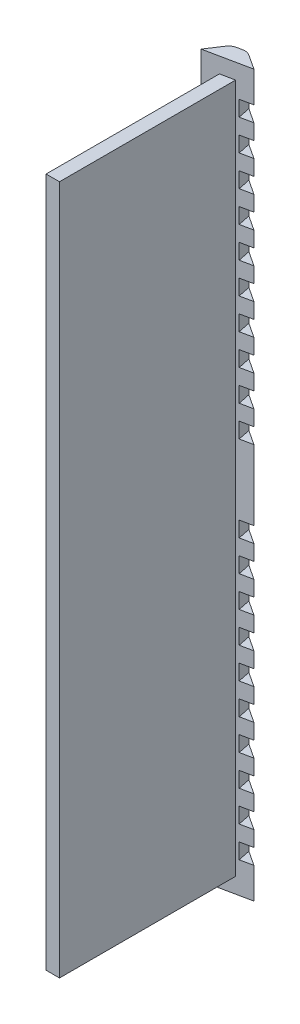
from build123d import *

# Parameters (mm, degrees)
BOSS_EXTRUDE1_START       = -8.15
BOSS_EXTRUDE1_DEPTH       = 66.8
SKETCH2_W                 = 4.327471502
SKETCH2_H                 = 69.8
BOSS_EXTRUDE2_DEPTH       = 1.5
CUT_EXTRUDE1_DEPTH        = 69.8
FILLET1_R                 = 1
CUT_EXTRUDE2_REACH        = 72.887
SKETCH6_W                 = 1.207106782
SKETCH6_H                 = 1.5
SKETCH6_W_2               = 1.207106781
LPATTERN1_COUNT           = 10
LPATTERN1_PITCH           = 3
MIRROR1_COPY_1_REACH      = 72.887
MIRROR1_COPY_1_SKETCH_W   = 1.207106782
MIRROR1_COPY_1_SKETCH_H   = 1.5
MIRROR1_COPY_1_SKETCH_W_2 = 1.207106781
MIRROR1_COPY_2_REACH      = 72.887
MIRROR1_COPY_2_SKETCH_W   = 1.207106782
MIRROR1_COPY_2_SKETCH_H   = 1.5
MIRROR1_COPY_2_SKETCH_W_2 = 1.207106781
MIRROR1_COPY_3_REACH      = 72.887
MIRROR1_COPY_3_SKETCH_W   = 1.207106782
MIRROR1_COPY_3_SKETCH_H   = 1.5
MIRROR1_COPY_3_SKETCH_W_2 = 1.207106781
MIRROR1_COPY_4_REACH      = 72.887
MIRROR1_COPY_4_SKETCH_W   = 1.207106782
MIRROR1_COPY_4_SKETCH_H   = 1.5
MIRROR1_COPY_4_SKETCH_W_2 = 1.207106781
MIRROR1_COPY_5_REACH      = 72.887
MIRROR1_COPY_5_SKETCH_W   = 1.207106782
MIRROR1_COPY_5_SKETCH_H   = 1.5
MIRROR1_COPY_5_SKETCH_W_2 = 1.207106781
MIRROR1_COPY_6_REACH      = 72.887
MIRROR1_COPY_6_SKETCH_W   = 1.207106782
MIRROR1_COPY_6_SKETCH_H   = 1.5
MIRROR1_COPY_6_SKETCH_W_2 = 1.207106781
MIRROR1_COPY_7_REACH      = 72.887
MIRROR1_COPY_7_SKETCH_W   = 1.207106782
MIRROR1_COPY_7_SKETCH_H   = 1.5
MIRROR1_COPY_7_SKETCH_W_2 = 1.207106781
MIRROR1_COPY_8_REACH      = 72.887
MIRROR1_COPY_8_SKETCH_W   = 1.207106782
MIRROR1_COPY_8_SKETCH_H   = 1.5
MIRROR1_COPY_8_SKETCH_W_2 = 1.207106781
MIRROR1_COPY_9_REACH      = 72.887
MIRROR1_COPY_9_SKETCH_W   = 1.207106782
MIRROR1_COPY_9_SKETCH_H   = 1.5
MIRROR1_COPY_9_SKETCH_W_2 = 1.207106781


# Read off the part's stored shape, not the designer's step: Boss-Extrude1
with BuildPart() as part:
    # Boss-Extrude1 outline → Boss-Extrude1 (new body)
    with BuildSketch(Plane(origin=(0, 0, 0), x_dir=(1, 0, 0), z_dir=(0, 1, 0)).offset(BOSS_EXTRUDE1_START)):
        Polygon((31.37, 0), (32.67, 0), (32.67, 17.061741827), (31.37, 16.793077374), align=None)
    extrude(amount=BOSS_EXTRUDE1_DEPTH)

    # Sketch2 → Boss-Extrude2 (add)
    with BuildSketch(Plane(origin=(-2.043439135, 0, -9.887690171), x_dir=(-0.9793053922908311, 0, 0.20238811385578323), z_dir=(-0.20238811385578323, 0, -0.9793053922908311))):
        with Locations((-34.783265163, 25.25)):
            Rectangle(SKETCH2_W, SKETCH2_H)
    extrude(amount=BOSS_EXTRUDE2_DEPTH)

    # Sketch3 → Cut-Extrude1 (cut)
    with BuildSketch(Plane.XZ.offset(9.65)):
        Polygon((34.138958088, -17.365323998), (32.366417829, -18.530699916), (33.835375918, -18.834282087), align=None)
        Polygon((31.066417829, -18.262035462), (29.901041912, -16.489495203), (29.597459741, -17.958453291), align=None)
    extrude(amount=-CUT_EXTRUDE1_DEPTH, mode=Mode.SUBTRACT)

    # Fillet1
    fillet1_edges = [part.edges().sort_by_distance(p)[0] for p in [
        (32.366417829, 25.25, -18.530699916),
        (31.066417829, 25.25, -18.262035462),
    ]]
    fillet(fillet1_edges, radius=FILLET1_R)

    # Cut-Extrude2: up to this face of the body (flat: up to its plane)
    cut_extrude2_end = Plane(part.part.faces().sort_by_distance((31.716417829, 25.25, -18.396367689))[0])
    # Sketch6 → Cut-Extrude2 (cut, up to the picked face)
    with BuildSketch(Plane(origin=(-2.043439135, 0, -9.887690171), x_dir=(0.9793053922908311, 0, -0.20238811385578315), z_dir=(0.20238811385578315, 0, 0.9793053922908311)), mode=Mode.PRIVATE) as cut_extrude2_sk1:
        with Locations((36.343447523, -5.9)):
            Rectangle(SKETCH6_W, SKETCH6_H)
    cut_extrude2_tool1 = split(extrude(cut_extrude2_sk1.sketch, amount=-CUT_EXTRUDE2_REACH, mode=Mode.PRIVATE), bisect_by=cut_extrude2_end, keep=Keep.BOTH, mode=Mode.PRIVATE)
    # Sketch6 → Cut-Extrude2 (cut, up to the picked face)
    with BuildSketch(Plane(origin=(-2.043439135, 0, -9.887690171), x_dir=(0.9793053922908311, 0, -0.20238811385578315), z_dir=(0.20238811385578315, 0, 0.9793053922908311)), mode=Mode.PRIVATE) as cut_extrude2_sk2:
        with Locations((33.223082803, -5.9)):
            Rectangle(SKETCH6_W_2, SKETCH6_H)
    cut_extrude2_tool2 = split(extrude(cut_extrude2_sk2.sketch, amount=-CUT_EXTRUDE2_REACH, mode=Mode.PRIVATE), bisect_by=cut_extrude2_end, keep=Keep.BOTH, mode=Mode.PRIVATE)
    cut_extrude2_1 = cut_extrude2_tool1.solids().sort_by(Axis((33.547895, -5.9, -17.243172), (-0.20238811385578315, 0, -0.9793053922908311)))[0]
    add(cut_extrude2_1, mode=Mode.SUBTRACT)
    cut_extrude2_2 = cut_extrude2_tool2.solids().sort_by(Axis((30.492105, -5.9, -16.611647), (-0.20238811385578315, 0, -0.9793053922908311)))[0]
    add(cut_extrude2_2, mode=Mode.SUBTRACT)
    cut_extrude2 = cut_extrude2_1 + cut_extrude2_2  # Cut-Extrude2 as one shape, for the pattern or mirror that repeats it

    # LPattern1: Cut-Extrude2 ×10
    with Locations(*[(0, i * LPATTERN1_PITCH, 0) for i in range(1, LPATTERN1_COUNT)]):
        add(cut_extrude2, mode=Mode.SUBTRACT)

    # Mirror1: Cut-Extrude2 across plane
    add(cut_extrude2.mirror(Plane(origin=(0, 25.25, 0), x_dir=(0, 0, 1), z_dir=(0, -1, 0))), mode=Mode.SUBTRACT)

    # Mirror1 copy 1: up to this face of the body (flat: up to its plane)
    mirror1_copy_1_end = Plane(part.part.faces().sort_by_distance((31.716417829, 22.25, -18.396367689))[0])
    # Mirror1 copy 1 sketch → Mirror1 copy 1 (cut, up to the picked face)
    with BuildSketch(Plane(origin=(-2.043439135, 47.5, -9.887690171), x_dir=(0.9793053922908311, 1.2025891852900813e-15, -0.20238811385578315), z_dir=(0.20238811385578315, 0, 0.9793053922908311)), mode=Mode.PRIVATE) as mirror1_copy_1_sk1:
        with Locations((36.343447523, 5.9)):
            Rectangle(MIRROR1_COPY_1_SKETCH_W, MIRROR1_COPY_1_SKETCH_H)
    mirror1_copy_1_tool1 = split(extrude(mirror1_copy_1_sk1.sketch, amount=-MIRROR1_COPY_1_REACH, mode=Mode.PRIVATE), bisect_by=mirror1_copy_1_end, keep=Keep.BOTH, mode=Mode.PRIVATE)
    # Mirror1 copy 1 sketch → Mirror1 copy 1 (cut, up to the picked face)
    with BuildSketch(Plane(origin=(-2.043439135, 47.5, -9.887690171), x_dir=(0.9793053922908311, 1.2025891852900813e-15, -0.20238811385578315), z_dir=(0.20238811385578315, 0, 0.9793053922908311)), mode=Mode.PRIVATE) as mirror1_copy_1_sk2:
        with Locations((33.223082803, 5.9)):
            Rectangle(MIRROR1_COPY_1_SKETCH_W_2, MIRROR1_COPY_1_SKETCH_H)
    mirror1_copy_1_tool2 = split(extrude(mirror1_copy_1_sk2.sketch, amount=-MIRROR1_COPY_1_REACH, mode=Mode.PRIVATE), bisect_by=mirror1_copy_1_end, keep=Keep.BOTH, mode=Mode.PRIVATE)
    add(mirror1_copy_1_tool1.solids().sort_by(Axis((33.547895, 53.4, -17.243172), (-0.20238811385578315, 0, -0.9793053922908311)))[0], mode=Mode.SUBTRACT)
    add(mirror1_copy_1_tool2.solids().sort_by(Axis((30.492105, 53.4, -16.611647), (-0.20238811385578315, 0, -0.9793053922908311)))[0], mode=Mode.SUBTRACT)

    # Mirror1 copy 2: up to this face of the body (flat: up to its plane)
    mirror1_copy_2_end = Plane(part.part.faces().sort_by_distance((31.716417829, 19.25, -18.396367689))[0])
    # Mirror1 copy 2 sketch → Mirror1 copy 2 (cut, up to the picked face)
    with BuildSketch(Plane(origin=(-2.043439135, 44.5, -9.887690171), x_dir=(0.9793053922908311, 1.2025891852900813e-15, -0.20238811385578315), z_dir=(0.20238811385578315, 0, 0.9793053922908311)), mode=Mode.PRIVATE) as mirror1_copy_2_sk1:
        with Locations((36.343447523, 5.9)):
            Rectangle(MIRROR1_COPY_2_SKETCH_W, MIRROR1_COPY_2_SKETCH_H)
    mirror1_copy_2_tool1 = split(extrude(mirror1_copy_2_sk1.sketch, amount=-MIRROR1_COPY_2_REACH, mode=Mode.PRIVATE), bisect_by=mirror1_copy_2_end, keep=Keep.BOTH, mode=Mode.PRIVATE)
    # Mirror1 copy 2 sketch → Mirror1 copy 2 (cut, up to the picked face)
    with BuildSketch(Plane(origin=(-2.043439135, 44.5, -9.887690171), x_dir=(0.9793053922908311, 1.2025891852900813e-15, -0.20238811385578315), z_dir=(0.20238811385578315, 0, 0.9793053922908311)), mode=Mode.PRIVATE) as mirror1_copy_2_sk2:
        with Locations((33.223082803, 5.9)):
            Rectangle(MIRROR1_COPY_2_SKETCH_W_2, MIRROR1_COPY_2_SKETCH_H)
    mirror1_copy_2_tool2 = split(extrude(mirror1_copy_2_sk2.sketch, amount=-MIRROR1_COPY_2_REACH, mode=Mode.PRIVATE), bisect_by=mirror1_copy_2_end, keep=Keep.BOTH, mode=Mode.PRIVATE)
    add(mirror1_copy_2_tool1.solids().sort_by(Axis((33.547895, 50.4, -17.243172), (-0.20238811385578315, 0, -0.9793053922908311)))[0], mode=Mode.SUBTRACT)
    add(mirror1_copy_2_tool2.solids().sort_by(Axis((30.492105, 50.4, -16.611647), (-0.20238811385578315, 0, -0.9793053922908311)))[0], mode=Mode.SUBTRACT)

    # Mirror1 copy 3: up to this face of the body (flat: up to its plane)
    mirror1_copy_3_end = Plane(part.part.faces().sort_by_distance((31.716417829, 16.25, -18.396367689))[0])
    # Mirror1 copy 3 sketch → Mirror1 copy 3 (cut, up to the picked face)
    with BuildSketch(Plane(origin=(-2.043439135, 41.5, -9.887690171), x_dir=(0.9793053922908311, 1.2025891852900813e-15, -0.20238811385578315), z_dir=(0.20238811385578315, 0, 0.9793053922908311)), mode=Mode.PRIVATE) as mirror1_copy_3_sk1:
        with Locations((36.343447523, 5.9)):
            Rectangle(MIRROR1_COPY_3_SKETCH_W, MIRROR1_COPY_3_SKETCH_H)
    mirror1_copy_3_tool1 = split(extrude(mirror1_copy_3_sk1.sketch, amount=-MIRROR1_COPY_3_REACH, mode=Mode.PRIVATE), bisect_by=mirror1_copy_3_end, keep=Keep.BOTH, mode=Mode.PRIVATE)
    # Mirror1 copy 3 sketch → Mirror1 copy 3 (cut, up to the picked face)
    with BuildSketch(Plane(origin=(-2.043439135, 41.5, -9.887690171), x_dir=(0.9793053922908311, 1.2025891852900813e-15, -0.20238811385578315), z_dir=(0.20238811385578315, 0, 0.9793053922908311)), mode=Mode.PRIVATE) as mirror1_copy_3_sk2:
        with Locations((33.223082803, 5.9)):
            Rectangle(MIRROR1_COPY_3_SKETCH_W_2, MIRROR1_COPY_3_SKETCH_H)
    mirror1_copy_3_tool2 = split(extrude(mirror1_copy_3_sk2.sketch, amount=-MIRROR1_COPY_3_REACH, mode=Mode.PRIVATE), bisect_by=mirror1_copy_3_end, keep=Keep.BOTH, mode=Mode.PRIVATE)
    add(mirror1_copy_3_tool1.solids().sort_by(Axis((33.547895, 47.4, -17.243172), (-0.20238811385578315, 0, -0.9793053922908311)))[0], mode=Mode.SUBTRACT)
    add(mirror1_copy_3_tool2.solids().sort_by(Axis((30.492105, 47.4, -16.611647), (-0.20238811385578315, 0, -0.9793053922908311)))[0], mode=Mode.SUBTRACT)

    # Mirror1 copy 4: up to this face of the body (flat: up to its plane)
    mirror1_copy_4_end = Plane(part.part.faces().sort_by_distance((31.716417829, 13.25, -18.396367689))[0])
    # Mirror1 copy 4 sketch → Mirror1 copy 4 (cut, up to the picked face)
    with BuildSketch(Plane(origin=(-2.043439135, 38.5, -9.887690171), x_dir=(0.9793053922908311, 1.2025891852900813e-15, -0.20238811385578315), z_dir=(0.20238811385578315, 0, 0.9793053922908311)), mode=Mode.PRIVATE) as mirror1_copy_4_sk1:
        with Locations((36.343447523, 5.9)):
            Rectangle(MIRROR1_COPY_4_SKETCH_W, MIRROR1_COPY_4_SKETCH_H)
    mirror1_copy_4_tool1 = split(extrude(mirror1_copy_4_sk1.sketch, amount=-MIRROR1_COPY_4_REACH, mode=Mode.PRIVATE), bisect_by=mirror1_copy_4_end, keep=Keep.BOTH, mode=Mode.PRIVATE)
    # Mirror1 copy 4 sketch → Mirror1 copy 4 (cut, up to the picked face)
    with BuildSketch(Plane(origin=(-2.043439135, 38.5, -9.887690171), x_dir=(0.9793053922908311, 1.2025891852900813e-15, -0.20238811385578315), z_dir=(0.20238811385578315, 0, 0.9793053922908311)), mode=Mode.PRIVATE) as mirror1_copy_4_sk2:
        with Locations((33.223082803, 5.9)):
            Rectangle(MIRROR1_COPY_4_SKETCH_W_2, MIRROR1_COPY_4_SKETCH_H)
    mirror1_copy_4_tool2 = split(extrude(mirror1_copy_4_sk2.sketch, amount=-MIRROR1_COPY_4_REACH, mode=Mode.PRIVATE), bisect_by=mirror1_copy_4_end, keep=Keep.BOTH, mode=Mode.PRIVATE)
    add(mirror1_copy_4_tool1.solids().sort_by(Axis((33.547895, 44.4, -17.243172), (-0.20238811385578315, 0, -0.9793053922908311)))[0], mode=Mode.SUBTRACT)
    add(mirror1_copy_4_tool2.solids().sort_by(Axis((30.492105, 44.4, -16.611647), (-0.20238811385578315, 0, -0.9793053922908311)))[0], mode=Mode.SUBTRACT)

    # Mirror1 copy 5: up to this face of the body (flat: up to its plane)
    mirror1_copy_5_end = Plane(part.part.faces().sort_by_distance((31.716417829, 10.25, -18.396367689))[0])
    # Mirror1 copy 5 sketch → Mirror1 copy 5 (cut, up to the picked face)
    with BuildSketch(Plane(origin=(-2.043439135, 35.5, -9.887690171), x_dir=(0.9793053922908311, 1.2025891852900813e-15, -0.20238811385578315), z_dir=(0.20238811385578315, 0, 0.9793053922908311)), mode=Mode.PRIVATE) as mirror1_copy_5_sk1:
        with Locations((36.343447523, 5.9)):
            Rectangle(MIRROR1_COPY_5_SKETCH_W, MIRROR1_COPY_5_SKETCH_H)
    mirror1_copy_5_tool1 = split(extrude(mirror1_copy_5_sk1.sketch, amount=-MIRROR1_COPY_5_REACH, mode=Mode.PRIVATE), bisect_by=mirror1_copy_5_end, keep=Keep.BOTH, mode=Mode.PRIVATE)
    # Mirror1 copy 5 sketch → Mirror1 copy 5 (cut, up to the picked face)
    with BuildSketch(Plane(origin=(-2.043439135, 35.5, -9.887690171), x_dir=(0.9793053922908311, 1.2025891852900813e-15, -0.20238811385578315), z_dir=(0.20238811385578315, 0, 0.9793053922908311)), mode=Mode.PRIVATE) as mirror1_copy_5_sk2:
        with Locations((33.223082803, 5.9)):
            Rectangle(MIRROR1_COPY_5_SKETCH_W_2, MIRROR1_COPY_5_SKETCH_H)
    mirror1_copy_5_tool2 = split(extrude(mirror1_copy_5_sk2.sketch, amount=-MIRROR1_COPY_5_REACH, mode=Mode.PRIVATE), bisect_by=mirror1_copy_5_end, keep=Keep.BOTH, mode=Mode.PRIVATE)
    add(mirror1_copy_5_tool1.solids().sort_by(Axis((33.547895, 41.4, -17.243172), (-0.20238811385578315, 0, -0.9793053922908311)))[0], mode=Mode.SUBTRACT)
    add(mirror1_copy_5_tool2.solids().sort_by(Axis((30.492105, 41.4, -16.611647), (-0.20238811385578315, 0, -0.9793053922908311)))[0], mode=Mode.SUBTRACT)

    # Mirror1 copy 6: up to this face of the body (flat: up to its plane)
    mirror1_copy_6_end = Plane(part.part.faces().sort_by_distance((31.716417829, 7.25, -18.396367689))[0])
    # Mirror1 copy 6 sketch → Mirror1 copy 6 (cut, up to the picked face)
    with BuildSketch(Plane(origin=(-2.043439135, 32.5, -9.887690171), x_dir=(0.9793053922908311, 1.2025891852900813e-15, -0.20238811385578315), z_dir=(0.20238811385578315, 0, 0.9793053922908311)), mode=Mode.PRIVATE) as mirror1_copy_6_sk1:
        with Locations((36.343447523, 5.9)):
            Rectangle(MIRROR1_COPY_6_SKETCH_W, MIRROR1_COPY_6_SKETCH_H)
    mirror1_copy_6_tool1 = split(extrude(mirror1_copy_6_sk1.sketch, amount=-MIRROR1_COPY_6_REACH, mode=Mode.PRIVATE), bisect_by=mirror1_copy_6_end, keep=Keep.BOTH, mode=Mode.PRIVATE)
    # Mirror1 copy 6 sketch → Mirror1 copy 6 (cut, up to the picked face)
    with BuildSketch(Plane(origin=(-2.043439135, 32.5, -9.887690171), x_dir=(0.9793053922908311, 1.2025891852900813e-15, -0.20238811385578315), z_dir=(0.20238811385578315, 0, 0.9793053922908311)), mode=Mode.PRIVATE) as mirror1_copy_6_sk2:
        with Locations((33.223082803, 5.9)):
            Rectangle(MIRROR1_COPY_6_SKETCH_W_2, MIRROR1_COPY_6_SKETCH_H)
    mirror1_copy_6_tool2 = split(extrude(mirror1_copy_6_sk2.sketch, amount=-MIRROR1_COPY_6_REACH, mode=Mode.PRIVATE), bisect_by=mirror1_copy_6_end, keep=Keep.BOTH, mode=Mode.PRIVATE)
    add(mirror1_copy_6_tool1.solids().sort_by(Axis((33.547895, 38.4, -17.243172), (-0.20238811385578315, 0, -0.9793053922908311)))[0], mode=Mode.SUBTRACT)
    add(mirror1_copy_6_tool2.solids().sort_by(Axis((30.492105, 38.4, -16.611647), (-0.20238811385578315, 0, -0.9793053922908311)))[0], mode=Mode.SUBTRACT)

    # Mirror1 copy 7: up to this face of the body (flat: up to its plane)
    mirror1_copy_7_end = Plane(part.part.faces().sort_by_distance((31.716417829, 4.25, -18.396367689))[0])
    # Mirror1 copy 7 sketch → Mirror1 copy 7 (cut, up to the picked face)
    with BuildSketch(Plane(origin=(-2.043439135, 29.5, -9.887690171), x_dir=(0.9793053922908311, 1.2025891852900813e-15, -0.20238811385578315), z_dir=(0.20238811385578315, 0, 0.9793053922908311)), mode=Mode.PRIVATE) as mirror1_copy_7_sk1:
        with Locations((36.343447523, 5.9)):
            Rectangle(MIRROR1_COPY_7_SKETCH_W, MIRROR1_COPY_7_SKETCH_H)
    mirror1_copy_7_tool1 = split(extrude(mirror1_copy_7_sk1.sketch, amount=-MIRROR1_COPY_7_REACH, mode=Mode.PRIVATE), bisect_by=mirror1_copy_7_end, keep=Keep.BOTH, mode=Mode.PRIVATE)
    # Mirror1 copy 7 sketch → Mirror1 copy 7 (cut, up to the picked face)
    with BuildSketch(Plane(origin=(-2.043439135, 29.5, -9.887690171), x_dir=(0.9793053922908311, 1.2025891852900813e-15, -0.20238811385578315), z_dir=(0.20238811385578315, 0, 0.9793053922908311)), mode=Mode.PRIVATE) as mirror1_copy_7_sk2:
        with Locations((33.223082803, 5.9)):
            Rectangle(MIRROR1_COPY_7_SKETCH_W_2, MIRROR1_COPY_7_SKETCH_H)
    mirror1_copy_7_tool2 = split(extrude(mirror1_copy_7_sk2.sketch, amount=-MIRROR1_COPY_7_REACH, mode=Mode.PRIVATE), bisect_by=mirror1_copy_7_end, keep=Keep.BOTH, mode=Mode.PRIVATE)
    add(mirror1_copy_7_tool1.solids().sort_by(Axis((33.547895, 35.4, -17.243172), (-0.20238811385578315, 0, -0.9793053922908311)))[0], mode=Mode.SUBTRACT)
    add(mirror1_copy_7_tool2.solids().sort_by(Axis((30.492105, 35.4, -16.611647), (-0.20238811385578315, 0, -0.9793053922908311)))[0], mode=Mode.SUBTRACT)

    # Mirror1 copy 8: up to this face of the body (flat: up to its plane)
    mirror1_copy_8_end = Plane(part.part.faces().sort_by_distance((31.716417829, 1.25, -18.396367689))[0])
    # Mirror1 copy 8 sketch → Mirror1 copy 8 (cut, up to the picked face)
    with BuildSketch(Plane(origin=(-2.043439135, 26.5, -9.887690171), x_dir=(0.9793053922908311, 1.2025891852900813e-15, -0.20238811385578315), z_dir=(0.20238811385578315, 0, 0.9793053922908311)), mode=Mode.PRIVATE) as mirror1_copy_8_sk1:
        with Locations((36.343447523, 5.9)):
            Rectangle(MIRROR1_COPY_8_SKETCH_W, MIRROR1_COPY_8_SKETCH_H)
    mirror1_copy_8_tool1 = split(extrude(mirror1_copy_8_sk1.sketch, amount=-MIRROR1_COPY_8_REACH, mode=Mode.PRIVATE), bisect_by=mirror1_copy_8_end, keep=Keep.BOTH, mode=Mode.PRIVATE)
    # Mirror1 copy 8 sketch → Mirror1 copy 8 (cut, up to the picked face)
    with BuildSketch(Plane(origin=(-2.043439135, 26.5, -9.887690171), x_dir=(0.9793053922908311, 1.2025891852900813e-15, -0.20238811385578315), z_dir=(0.20238811385578315, 0, 0.9793053922908311)), mode=Mode.PRIVATE) as mirror1_copy_8_sk2:
        with Locations((33.223082803, 5.9)):
            Rectangle(MIRROR1_COPY_8_SKETCH_W_2, MIRROR1_COPY_8_SKETCH_H)
    mirror1_copy_8_tool2 = split(extrude(mirror1_copy_8_sk2.sketch, amount=-MIRROR1_COPY_8_REACH, mode=Mode.PRIVATE), bisect_by=mirror1_copy_8_end, keep=Keep.BOTH, mode=Mode.PRIVATE)
    add(mirror1_copy_8_tool1.solids().sort_by(Axis((33.547895, 32.4, -17.243172), (-0.20238811385578315, 0, -0.9793053922908311)))[0], mode=Mode.SUBTRACT)
    add(mirror1_copy_8_tool2.solids().sort_by(Axis((30.492105, 32.4, -16.611647), (-0.20238811385578315, 0, -0.9793053922908311)))[0], mode=Mode.SUBTRACT)

    # Mirror1 copy 9: up to this face of the body (flat: up to its plane)
    mirror1_copy_9_end = Plane(part.part.faces().sort_by_distance((31.716417829, -1.75, -18.396367689))[0])
    # Mirror1 copy 9 sketch → Mirror1 copy 9 (cut, up to the picked face)
    with BuildSketch(Plane(origin=(-2.043439135, 23.5, -9.887690171), x_dir=(0.9793053922908311, 1.2025891852900813e-15, -0.20238811385578315), z_dir=(0.20238811385578315, 0, 0.9793053922908311)), mode=Mode.PRIVATE) as mirror1_copy_9_sk1:
        with Locations((36.343447523, 5.9)):
            Rectangle(MIRROR1_COPY_9_SKETCH_W, MIRROR1_COPY_9_SKETCH_H)
    mirror1_copy_9_tool1 = split(extrude(mirror1_copy_9_sk1.sketch, amount=-MIRROR1_COPY_9_REACH, mode=Mode.PRIVATE), bisect_by=mirror1_copy_9_end, keep=Keep.BOTH, mode=Mode.PRIVATE)
    # Mirror1 copy 9 sketch → Mirror1 copy 9 (cut, up to the picked face)
    with BuildSketch(Plane(origin=(-2.043439135, 23.5, -9.887690171), x_dir=(0.9793053922908311, 1.2025891852900813e-15, -0.20238811385578315), z_dir=(0.20238811385578315, 0, 0.9793053922908311)), mode=Mode.PRIVATE) as mirror1_copy_9_sk2:
        with Locations((33.223082803, 5.9)):
            Rectangle(MIRROR1_COPY_9_SKETCH_W_2, MIRROR1_COPY_9_SKETCH_H)
    mirror1_copy_9_tool2 = split(extrude(mirror1_copy_9_sk2.sketch, amount=-MIRROR1_COPY_9_REACH, mode=Mode.PRIVATE), bisect_by=mirror1_copy_9_end, keep=Keep.BOTH, mode=Mode.PRIVATE)
    add(mirror1_copy_9_tool1.solids().sort_by(Axis((33.547895, 29.4, -17.243172), (-0.20238811385578315, 0, -0.9793053922908311)))[0], mode=Mode.SUBTRACT)
    add(mirror1_copy_9_tool2.solids().sort_by(Axis((30.492105, 29.4, -16.611647), (-0.20238811385578315, 0, -0.9793053922908311)))[0], mode=Mode.SUBTRACT)


solid = part.part
